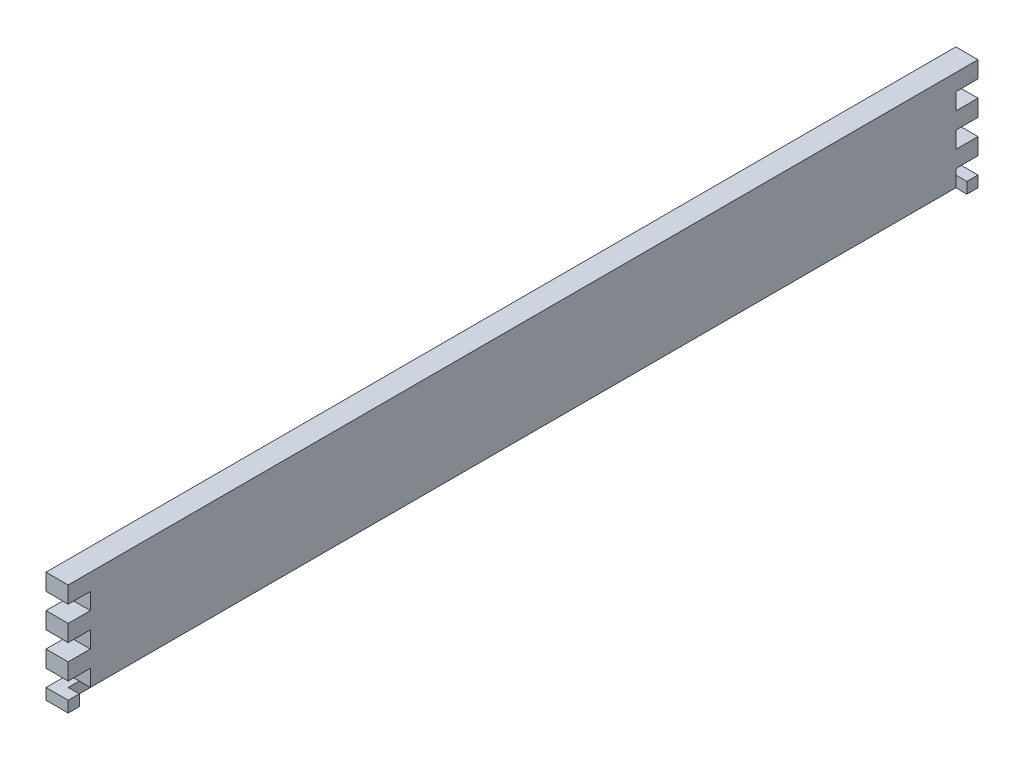
from build123d import *

# Parameters (mm, degrees)
EXTRUDE_1_DEPTH                  = 820
SKETCH_3_W                       = 10
SKETCH_3_H                       = 10
EXTRUDE_2_DEPTH                  = 10
SKETCH_4_W                       = 20
SKETCH_4_H                       = 15
CUT_EXTRUDE_1_DEPTH              = 827.317130405
PATTERN_LINEAR_1_COUNT           = 3
PATTERN_LINEAR_1_PITCH           = 30
PATTERN_LINEAR_2_COPY_1_SKETCH_W = 20
PATTERN_LINEAR_2_COPY_1_SKETCH_H = 15
PATTERN_LINEAR_2_COPY_1_DEPTH    = 827.317130405
PATTERN_LINEAR_2_COPY_2_SKETCH_W = 20
PATTERN_LINEAR_2_COPY_2_SKETCH_H = 15
PATTERN_LINEAR_2_COPY_2_DEPTH    = 827.317130405
PATTERN_LINEAR_2_COPY_3_SKETCH_W = 20
PATTERN_LINEAR_2_COPY_3_SKETCH_H = 15
PATTERN_LINEAR_2_COPY_3_DEPTH    = 827.317130405


with BuildPart() as part:
    # Эскиз1 → Бобышка-Вытянуть1 (new body)
    with BuildSketch(Plane.XY):
        Polygon((0, 0), (0, 100), (20, 100), (20, 10), (10, 10), (10, 0), align=None)
    extrude(amount=EXTRUDE_1_DEPTH)

    # Эскиз3 → Бобышка-Вытянуть2 (add)
    with BuildSketch(Plane(origin=(10, 0, 0), x_dir=(0, 0, -1), z_dir=(1, 0, 0))):
        with Locations((-815, 5)):
            Rectangle(SKETCH_3_W, SKETCH_3_H)
        with Locations((-5, 5)):
            Rectangle(SKETCH_3_W, SKETCH_3_H)
    extrude(amount=EXTRUDE_2_DEPTH)

    # Эскиз4 → Вырез-Вытянуть1 (cut, through all)
    with BuildSketch(Plane.ZY):
        with Locations((810, 77.5)):
            Rectangle(SKETCH_4_W, SKETCH_4_H)
    cut_extrude_1 = extrude(amount=-CUT_EXTRUDE_1_DEPTH, mode=Mode.SUBTRACT)

    # Линейный массив1: Вырез-Вытянуть1 ×3
    with Locations(*[(0, -i * PATTERN_LINEAR_1_PITCH, 0) for i in range(1, PATTERN_LINEAR_1_COUNT)]):
        add(cut_extrude_1, mode=Mode.SUBTRACT)

    # Линейный массив2 copy 1 sketch → Линейный массив2 copy 1 (cut, through all)
    with BuildSketch(Plane(origin=(0, -30, -800), x_dir=(0, 0, 1), z_dir=(-1, 0, 0))):
        with Locations((810, 77.5)):
            Rectangle(PATTERN_LINEAR_2_COPY_1_SKETCH_W, PATTERN_LINEAR_2_COPY_1_SKETCH_H)
    extrude(amount=-PATTERN_LINEAR_2_COPY_1_DEPTH, mode=Mode.SUBTRACT)

    # Линейный массив2 copy 2 sketch → Линейный массив2 copy 2 (cut, through all)
    with BuildSketch(Plane(origin=(0, -60, -800), x_dir=(0, 0, 1), z_dir=(-1, 0, 0))):
        with Locations((810, 77.5)):
            Rectangle(PATTERN_LINEAR_2_COPY_2_SKETCH_W, PATTERN_LINEAR_2_COPY_2_SKETCH_H)
    extrude(amount=-PATTERN_LINEAR_2_COPY_2_DEPTH, mode=Mode.SUBTRACT)

    # Линейный массив2 copy 3 sketch → Линейный массив2 copy 3 (cut, through all)
    with BuildSketch(Plane(origin=(0, 0, -800), x_dir=(0, 0, 1), z_dir=(-1, 0, 0))):
        with Locations((810, 77.5)):
            Rectangle(PATTERN_LINEAR_2_COPY_3_SKETCH_W, PATTERN_LINEAR_2_COPY_3_SKETCH_H)
    extrude(amount=-PATTERN_LINEAR_2_COPY_3_DEPTH, mode=Mode.SUBTRACT)


solid = part.part
